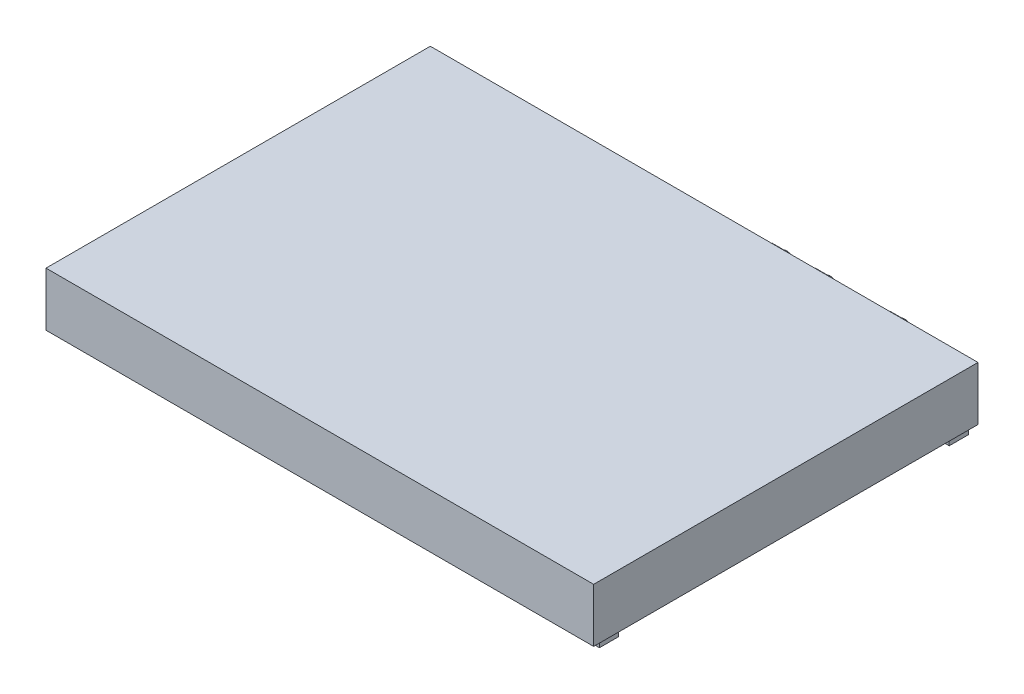
from build123d import *

# Parameters (mm, degrees)
SKIZZE1_W                       = 200
SKIZZE1_H                       = 28
AUFSATZ_LINEAR_AUSTRAGEN1_DEPTH = 142.5
SKIZZE2_W                       = 15
SKIZZE2_H                       = 20.7
AUFSATZ_LINEAR_AUSTRAGEN2_DEPTH = 2
AUFSATZ_LINEAR_AUSTRAGEN3_DEPTH = 5
AUFSATZ_LINEAR_AUSTRAGEN4_DEPTH = 4.7
SKIZZE6_R                       = 4.5
AUFSATZ_LINEAR_AUSTRAGEN5_DEPTH = 3.3
SKIZZE8_W                       = 10
SKIZZE8_H                       = 10
AUFSATZ_LINEAR_AUSTRAGEN6_DEPTH = 3.1
SPIEGELN2_COPY_1_SKETCH_W       = 10
SPIEGELN2_COPY_1_SKETCH_H       = 10
SPIEGELN2_COPY_1_DEPTH          = 3.1
SPIEGELN2_COPY_2_SKETCH_W       = 10
SPIEGELN2_COPY_2_SKETCH_H       = 10
SPIEGELN2_COPY_2_DEPTH          = 3.1


with BuildPart() as part:
    # Skizze1 → Aufsatz-Linear austragen1 (new, symmetric)
    with BuildSketch(Plane(origin=(0, 0, 0), x_dir=(0, 0, -1), z_dir=(1, 0, 0))):
        Rectangle(SKIZZE1_W, SKIZZE1_H)
    extrude(amount=AUFSATZ_LINEAR_AUSTRAGEN1_DEPTH, both=True)

    # Skizze2 → Aufsatz-Linear austragen2 (add)
    with BuildSketch(Plane(origin=(0, 0, -100), x_dir=(-1, 0, 0), z_dir=(0, 0, -1))):
        with Locations((130.5, 1.4)):
            Rectangle(SKIZZE2_W, SKIZZE2_H)
    extrude(amount=AUFSATZ_LINEAR_AUSTRAGEN2_DEPTH)

    # Skizze3 → Aufsatz-Linear austragen3 (add, symmetric)
    with BuildSketch(Plane.ZY.offset(130.5)):
        Polygon((-102, 9.25), (-106.5, 6.651923789), (-102, -6.95), align=None)
    extrude(amount=AUFSATZ_LINEAR_AUSTRAGEN3_DEPTH, both=True)

    # Skizze5 → Aufsatz-Linear austragen4 (add)
    with BuildSketch(Plane(origin=(0, 0, -100), x_dir=(-1, 0, 0), z_dir=(0, 0, -1))):
        Polygon((-100.830127019, -5.5), (-92.169872981, -5.5), (-87.839745962, 2), (-92.169872981, 9.5), (-100.830127019, 9.5), (-105.160254038, 2), align=None)
    aufsatz_linear_austragen4 = extrude(amount=AUFSATZ_LINEAR_AUSTRAGEN4_DEPTH)

    # Skizze6 → Aufsatz-Linear austragen5 (add)
    with BuildSketch(Plane(origin=(0, 0, -104.7), x_dir=(-1, 0, 0), z_dir=(0, 0, -1))):
        with Locations((-96.5, 2)):
            Circle(SKIZZE6_R)
    aufsatz_linear_austragen5 = extrude(amount=AUFSATZ_LINEAR_AUSTRAGEN5_DEPTH)

    # Skizzen-Muster1: Aufsatz-Linear austragen4, Aufsatz-Linear austragen5 at 2 more places
    with Locations((-39, 0, 0), (-61.5, 0, 0)):
        add(aufsatz_linear_austragen4)
        add(aufsatz_linear_austragen5)

    # Skizze8 → Aufsatz-Linear austragen6 (add)
    with BuildSketch(Plane.XZ.offset(14)):
        with Locations((136.5, -91)):
            Rectangle(SKIZZE8_W, SKIZZE8_H)
    aufsatz_linear_austragen6 = extrude(amount=AUFSATZ_LINEAR_AUSTRAGEN6_DEPTH)

    # Spiegeln1: Aufsatz-Linear austragen6 across plane
    add(aufsatz_linear_austragen6.mirror(Plane(origin=(0, 0, 0), x_dir=(0, 0, 1), z_dir=(1, 0, 0))))

    # Spiegeln2 copy 1 sketch → Spiegeln2 copy 1 (add)
    with BuildSketch(Plane(origin=(0, -14, 0), x_dir=(-1, 0, 0), z_dir=(0, -1, 0))):
        with Locations((136.5, -91)):
            Rectangle(SPIEGELN2_COPY_1_SKETCH_W, SPIEGELN2_COPY_1_SKETCH_H)
    extrude(amount=SPIEGELN2_COPY_1_DEPTH)

    # Spiegeln2 copy 2 sketch → Spiegeln2 copy 2 (add)
    with BuildSketch(Plane.XZ.offset(14)):
        with Locations((136.5, 91)):
            Rectangle(SPIEGELN2_COPY_2_SKETCH_W, SPIEGELN2_COPY_2_SKETCH_H)
    extrude(amount=SPIEGELN2_COPY_2_DEPTH)


solid = part.part
